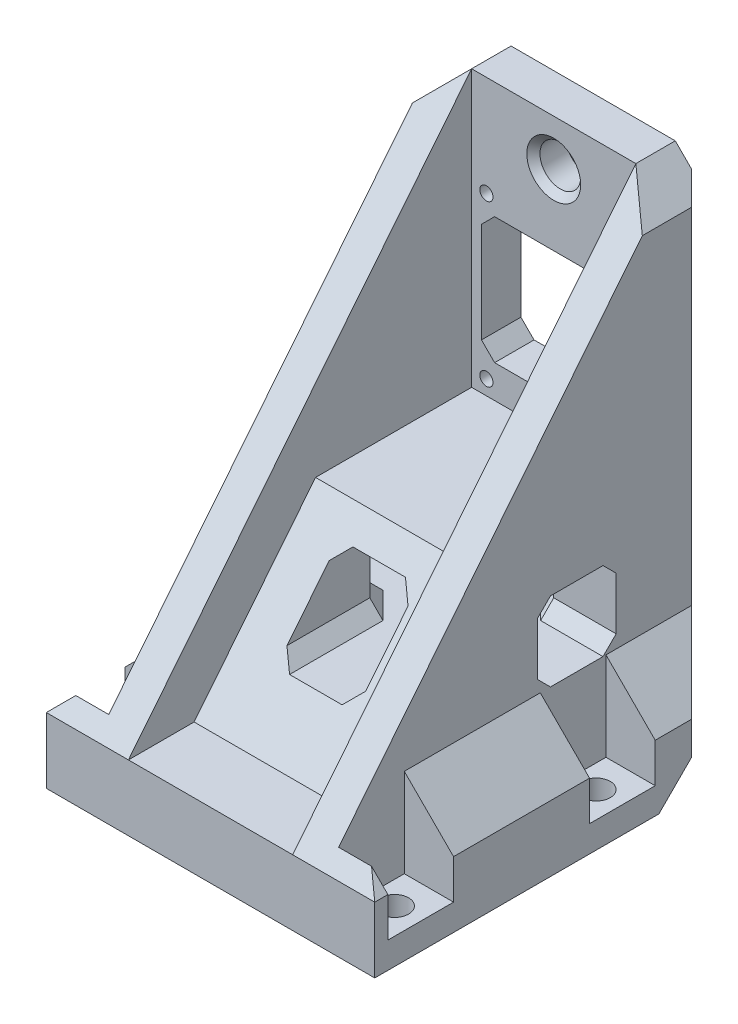
from build123d import *

# Parameters (mm, degrees)
SKETCH1_W               = 50
SKETCH1_H               = 58.25
BOSS_EXTRUDE1_DEPTH     = 10
SKETCH2_R               = 2.15
CUT_EXTRUDE1_DEPTH      = 4
SKETCH5_W               = 25
SKETCH5_H               = 6
BOSS_EXTRUDE3_DEPTH     = 65
CUT_EXTRUDE3_REACH      = 100.199
SKETCH6_W               = 22
SKETCH6_H               = 19.25
SKETCH7_R               = 1
CUT_EXTRUDE4_DEPTH      = 2.5
CUT_EXTRUDE5_REACH      = 98.164
SKETCH8_R               = 2
BOSS_EXTRUDE4_DEPTH     = 5
CHAMFER1_SIZE           = 7.5
CHAMFER2_SIZE           = 10
CHAMFER4_SIZE           = 15
CHAMFER5_SIZE           = 5
CHAMFER7_SIZE           = 2
CUT_EXTRUDE6_REACH      = 100.199
SKETCH10_R              = 3.1
CHAMFER8_SIZE           = 1
BOSS_EXTRUDE5_REACH     = 90.767
CUT_EXTRUDE7_REACH      = 100.199
SKETCH12_W              = 12
SKETCH12_H              = 12
CUT_EXTRUDE9_REACH      = 88.222
SKETCH14_W              = 12
SKETCH14_H              = 12
CHAMFER11_SIZE          = 2
CUT_EXTRUDE12_OUTLINE_W = 10
CUT_EXTRUDE12_OUTLINE_H = 13.5
CUT_EXTRUDE12_DEPTH     = 7.5
LPATTERN1_COUNT         = 2
LPATTERN1_PITCH         = 30.7
MIRROR3_COPY_1_SKETCH_W = 10
MIRROR3_COPY_1_SKETCH_H = 13.5
MIRROR3_COPY_1_DEPTH    = 7.5


# Read off the part's stored shape, not the designer's step: Cut-Extrude12
with BuildPart() as part:
    # Sketch1 → Boss-Extrude1 (new body)
    with BuildSketch(Plane(origin=(0, 0, 0), x_dir=(1, 0, 0), z_dir=(0, 1, 0))):
        Rectangle(SKETCH1_W, SKETCH1_H)
    extrude(amount=BOSS_EXTRUDE1_DEPTH)

    # Sketch2 → Cut-Extrude1 (cut)
    with BuildSketch(Plane(origin=(0, 0, 0), x_dir=(1, 0, 0), z_dir=(0, 1, 0))):
        with Locations(Location((-21, 8.575, 0), (0, 0, 270))):
            Circle(SKETCH2_R)
        with Locations(Location((-21, -22.125, 0), (0, 0, 270))):
            Circle(SKETCH2_R)
        with Locations(Location((21, 8.575, 0), (0, 0, 270))):
            Circle(SKETCH2_R)
        with Locations(Location((21, -22.125, 0), (0, 0, 270))):
            Circle(SKETCH2_R)
    extrude(amount=CUT_EXTRUDE1_DEPTH, mode=Mode.SUBTRACT)

    # Sketch5 → Boss-Extrude3 (add)
    with BuildSketch(Plane(origin=(0, 10, 0), x_dir=(1, 0, 0), z_dir=(0, 1, 0))):
        with Locations((0, 26.125)):
            Rectangle(SKETCH5_W, SKETCH5_H)
    extrude(amount=BOSS_EXTRUDE3_DEPTH)

    # Sketch6 → Cut-Extrude3 (cut, up to next)
    with BuildSketch(Plane(origin=(0, 0, -29.125), x_dir=(-1, 0, 0), z_dir=(0, 0, -1)), mode=Mode.PRIVATE) as cut_extrude3_sk1:
        with Locations((0, 47.625)):
            Rectangle(SKETCH6_W, SKETCH6_H)
    cut_extrude3_tool1 = extrude(cut_extrude3_sk1.sketch, amount=-CUT_EXTRUDE3_REACH, mode=Mode.PRIVATE) & part.part
    add(cut_extrude3_tool1.solids().sort_by_distance((0, 47.625, -29.125))[0], mode=Mode.SUBTRACT)

    # Sketch7 → Cut-Extrude4 (cut)
    with BuildSketch(Plane.XY.offset(-23.125)):
        with Locations((10.25, 35.25)):
            Circle(SKETCH7_R)
        with Locations((-10.25, 35.25)):
            Circle(SKETCH7_R)
        with Locations((-10.25, 59.7)):
            Circle(SKETCH7_R)
        with Locations((10.25, 59.7)):
            Circle(SKETCH7_R)
    extrude(amount=-CUT_EXTRUDE4_DEPTH, mode=Mode.SUBTRACT)

    # Sketch8 → Cut-Extrude5 (cut, up to next)
    with BuildSketch(Plane.XY.offset(-25.625), mode=Mode.PRIVATE) as cut_extrude5_sk1:
        with Locations((-10.25, 59.7)):
            Circle(SKETCH8_R)
    cut_extrude5_tool1 = extrude(cut_extrude5_sk1.sketch, amount=-CUT_EXTRUDE5_REACH, mode=Mode.PRIVATE) & part.part
    # Sketch8 → Cut-Extrude5 (cut, up to next)
    with BuildSketch(Plane.XY.offset(-25.625), mode=Mode.PRIVATE) as cut_extrude5_sk2:
        with Locations((10.25, 59.7)):
            Circle(SKETCH8_R)
    cut_extrude5_tool2 = extrude(cut_extrude5_sk2.sketch, amount=-CUT_EXTRUDE5_REACH, mode=Mode.PRIVATE) & part.part
    # Sketch8 → Cut-Extrude5 (cut, up to next)
    with BuildSketch(Plane.XY.offset(-25.625), mode=Mode.PRIVATE) as cut_extrude5_sk3:
        with Locations((10.25, 35.25)):
            Circle(SKETCH8_R)
    cut_extrude5_tool3 = extrude(cut_extrude5_sk3.sketch, amount=-CUT_EXTRUDE5_REACH, mode=Mode.PRIVATE) & part.part
    # Sketch8 → Cut-Extrude5 (cut, up to next)
    with BuildSketch(Plane.XY.offset(-25.625), mode=Mode.PRIVATE) as cut_extrude5_sk4:
        with Locations((-10.25, 35.25)):
            Circle(SKETCH8_R)
    cut_extrude5_tool4 = extrude(cut_extrude5_sk4.sketch, amount=-CUT_EXTRUDE5_REACH, mode=Mode.PRIVATE) & part.part
    add(cut_extrude5_tool1.solids().sort_by_distance((-10.25, 59.7, -25.625))[0], mode=Mode.SUBTRACT)
    add(cut_extrude5_tool2.solids().sort_by_distance((10.25, 59.7, -25.625))[0], mode=Mode.SUBTRACT)
    add(cut_extrude5_tool3.solids().sort_by_distance((10.25, 35.25, -25.625))[0], mode=Mode.SUBTRACT)
    add(cut_extrude5_tool4.solids().sort_by_distance((-10.25, 35.25, -25.625))[0], mode=Mode.SUBTRACT)

    # Sketch9 → Boss-Extrude4 (add)
    with BuildSketch(Plane(origin=(12.5, 0, 0), x_dir=(0, 0, -1), z_dir=(1, 0, 0))):
        Polygon((29.125, 75), (23.125, 75), (-29.125, 10), (29.125, 10), align=None)
    boss_extrude4 = extrude(amount=BOSS_EXTRUDE4_DEPTH)

    # Mirror1: Boss-Extrude4 across plane
    add(boss_extrude4.mirror(Plane(origin=(0, 0, 0), x_dir=(0, 0, 1), z_dir=(1, 0, 0))))

    # Chamfer1
    chamfer1_edges = [part.edges().sort_by_distance(p)[0] for p in [
        (17.5, 10, 0),
        (-17.5, 10, 0),
    ]]
    chamfer(chamfer1_edges, length=CHAMFER1_SIZE - 0.0001)  # a hair under: the kernel refuses the full size

    # Chamfer2
    chamfer2_edges = [part.edges().sort_by_distance(p)[0] for p in [
        (-25, 5, -29.125),
        (25, 5, -29.125),
    ]]
    chamfer(chamfer2_edges, length=CHAMFER2_SIZE)

    # Chamfer4
    chamfer4_edges = [part.edges().sort_by_distance(p)[0] for p in [
        (0, 0, -29.125),
    ]]
    chamfer(chamfer4_edges, length=CHAMFER4_SIZE)

    # Chamfer5
    chamfer5_edges = [part.edges().sort_by_distance(p)[0] for p in [
        (17.5, 75, -24.875),
        (-17.5, 75, -24.875),
    ]]
    chamfer(chamfer5_edges, length=CHAMFER5_SIZE)

    # Chamfer7
    chamfer7_edges = [part.edges().sort_by_distance(p)[0] for p in [
        (-11, 57.25, -26.125),
        (-11, 38, -26.125),
        (11, 38, -26.125),
        (11, 57.25, -26.125),
    ]]
    chamfer(chamfer7_edges, length=CHAMFER7_SIZE)

    # Sketch10 → Cut-Extrude6 (cut, up to next)
    with BuildSketch(Plane(origin=(0, 0, -29.125), x_dir=(-1, 0, 0), z_dir=(0, 0, -1)), mode=Mode.PRIVATE) as cut_extrude6_sk1:
        with Locations((0, 68)):
            Circle(SKETCH10_R)
    cut_extrude6_tool1 = extrude(cut_extrude6_sk1.sketch, amount=-CUT_EXTRUDE6_REACH, mode=Mode.PRIVATE) & part.part
    add(cut_extrude6_tool1.solids().sort_by_distance((0, 68, -29.125))[0], mode=Mode.SUBTRACT)

    # Chamfer8
    chamfer8_edges = [part.edges().sort_by_distance(p)[0] for p in [
        (3.1, 68, -29.125),
        (3.1, 68, -23.125),
    ]]
    chamfer(chamfer8_edges, length=CHAMFER8_SIZE)

    # Sketch11 → Boss-Extrude5 (add, up to next)
    with BuildSketch(Plane(origin=(-12.5, 0, 0), x_dir=(0, 0, -1), z_dir=(1, 0, 0)), mode=Mode.PRIVATE) as boss_extrude5_sk1:
        Polygon((-19.125, 10), (23.125, 10), (23.125, 33), (-0.636538462, 33), align=None)
    boss_extrude5_tool1 = extrude(boss_extrude5_sk1.sketch, amount=BOSS_EXTRUDE5_REACH, mode=Mode.PRIVATE) - part.part
    add(boss_extrude5_tool1.solids().sort_by_distance((-12.5, 20.426363, -6.190596))[0])

    # Cut-Extrude7: up to this plane
    cut_extrude7_end = Plane(origin=(25.002, 33, 0.636538462), z_dir=(0, -0.6265212074854106, -0.7794043729483581))
    # Sketch12 → Cut-Extrude7 (cut, up to the surface)
    with BuildSketch(Plane(origin=(0, 0, -29.125), x_dir=(-1, 0, 0), z_dir=(0, 0, -1)), mode=Mode.PRIVATE) as cut_extrude7_sk1:
        with Locations((0, 23.5)):
            Rectangle(SKETCH12_W, SKETCH12_H)
    cut_extrude7_tool1 = split(extrude(cut_extrude7_sk1.sketch, amount=-CUT_EXTRUDE7_REACH, mode=Mode.PRIVATE), bisect_by=cut_extrude7_end, keep=Keep.BOTH, mode=Mode.PRIVATE)
    add(cut_extrude7_tool1.solids().sort_by_distance((0, 23.5, -29.125))[0], mode=Mode.SUBTRACT)

    # Sketch14 → Cut-Extrude9 (cut, up to next)
    with BuildSketch(Plane(origin=(-6, 0, 0), x_dir=(0, 0, -1), z_dir=(1, 0, 0)), mode=Mode.PRIVATE) as cut_extrude9_sk1:
        with Locations((9.125, 23.5)):
            Rectangle(SKETCH14_W, SKETCH14_H)
    cut_extrude9_tool1 = extrude(cut_extrude9_sk1.sketch, amount=-CUT_EXTRUDE9_REACH, mode=Mode.PRIVATE) & part.part
    cut_extrude9 = cut_extrude9_tool1.solids().sort_by_distance((-6, 23.5, -9.125))[0]
    add(cut_extrude9, mode=Mode.SUBTRACT)

    # Mirror2: Cut-Extrude9 across plane
    add(cut_extrude9.mirror(Plane(origin=(0, 0, 0), x_dir=(0, 0, 1), z_dir=(1, 0, 0))), mode=Mode.SUBTRACT)

    # Chamfer11
    chamfer11_edges = [part.edges().sort_by_distance(p)[0] for p in [
        (-6, 17.5, 4.985576923),
        (6, 17.5, 4.985576923),
        (6, 29.5, 0.1625),
        (-6, 29.5, 0.1625),
        (-6, 17.5, -22.125),
        (-6, 29.5, -22.125),
        (-11.75, 17.5, -15.125),
        (-11.75, 29.5, -15.125),
        (-11.75, 17.5, -3.125),
        (-11.75, 29.5, -3.125),
        (-6, 23.5, -15.125),
        (-6, 23.5, -3.125),
        (6, 29.5, -22.125),
        (6, 17.5, -22.125),
        (11.75, 17.5, -3.125),
        (11.75, 17.5, -15.125),
        (6, 23.5, -15.125),
        (11.75, 29.5, -15.125),
        (11.75, 29.5, -3.125),
        (6, 23.5, -3.125),
    ]]
    chamfer(chamfer11_edges, length=CHAMFER11_SIZE)

    # Cut-Extrude12 outline → Cut-Extrude12 (cut)
    with BuildSketch(Plane(origin=(17.5, 0, 0), x_dir=(0, 0, -1), z_dir=(1, 0, 0))):
        with Locations((8.575, 10.75)):
            Rectangle(CUT_EXTRUDE12_OUTLINE_W, CUT_EXTRUDE12_OUTLINE_H)
    cut_extrude12 = extrude(amount=CUT_EXTRUDE12_DEPTH, mode=Mode.SUBTRACT)

    # LPattern1: Cut-Extrude12 ×2
    with Locations(*[(0, 0, i * LPATTERN1_PITCH) for i in range(1, LPATTERN1_COUNT)]):
        add(cut_extrude12, mode=Mode.SUBTRACT)

    # Mirror3: Cut-Extrude12 across plane
    add(cut_extrude12.mirror(Plane(origin=(0, 0, 0), x_dir=(0, 0, 1), z_dir=(1, 0, 0))), mode=Mode.SUBTRACT)

    # Mirror3 copy 1 sketch → Mirror3 copy 1 (cut)
    with BuildSketch(Plane(origin=(-17.5, 0, 30.7), x_dir=(0, 0, -1), z_dir=(-1, 0, 0))):
        with Locations((8.575, -10.75)):
            Rectangle(MIRROR3_COPY_1_SKETCH_W, MIRROR3_COPY_1_SKETCH_H)
    extrude(amount=MIRROR3_COPY_1_DEPTH, mode=Mode.SUBTRACT)


solid = part.part
